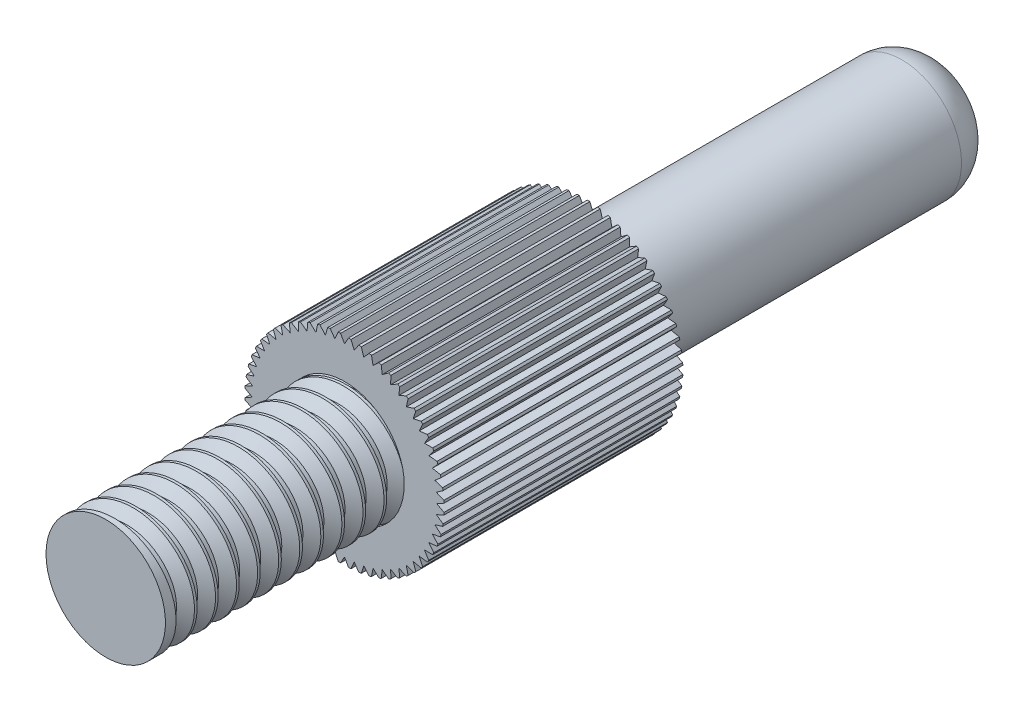
from build123d import *

# Parameters (mm, degrees)
SKETCH_1_R              = 1.5
EXTRUDE_1_DEPTH         = 21
EXTRUDE_START           = -9
SKETCH_2_R              = 2.5
EXTRUDE_2_DEPTH         = 6
CUT_EXTRUDE_START       = -6
CUT_EXTRUDE_3_OUTLINE_R = 2.5
CUT_EXTRUDE_3_DEPTH     = 6
THREAD_1_PITCH          = 0.529166667
FILLET_1_R              = 1


# Read off the part's stored shape, not the designer's step: Вырез-Вытянуть3
with BuildPart() as part:
    # Sketch 1 → Бобышка-Вытянуть1 (new body)
    with BuildSketch(Plane.XY):
        with Locations(Location((0, 0, 0), (0, 0, 180))):
            Circle(SKETCH_1_R)
    extrude(amount=EXTRUDE_1_DEPTH)

    # Эскиз2 → Бобышка-Вытянуть2 (add)
    with BuildSketch(Plane(origin=(0, 0, 0), x_dir=(-1, 0, 0), z_dir=(0, 0, -1)).offset(EXTRUDE_START)):
        Circle(SKETCH_2_R)
    extrude(amount=-EXTRUDE_2_DEPTH)

    # Вырез-Вытянуть3 outline → Вырез-Вытянуть3 (cut)
    with BuildSketch(Plane(origin=(0, 0, 9), x_dir=(-1, 0, 0), z_dir=(0, 0, -1)).offset(CUT_EXTRUDE_START)):
        Circle(CUT_EXTRUDE_3_OUTLINE_R)
        with BuildLine():
            ThreePointArc((-0.421477618, 2.463869725), (-0.39103289, 2.468884502), (-0.360528582, 2.473523104))
            Line((-0.360528582, 2.473523104), (-0.242417774, 2.306451055))
            Line((-0.242417774, 2.306451055), (-0.161624203, 2.494428797))
            ThreePointArc((-0.161624203, 2.494428797), (-0.130822068, 2.496233762), (-0.1, 2.497658385))
            Line((-0.1, 2.497658385), (0, 2.319155632))
            Line((0, 2.319155632), (0.1, 2.497658385))
            ThreePointArc((0.1, 2.497658385), (0.130822068, 2.496233762), (0.161624203, 2.494428797))
            Line((0.161624203, 2.494428797), (0.242417774, 2.306451055))
            Line((0.242417774, 2.306451055), (0.360528582, 2.473523104))
            ThreePointArc((0.360528582, 2.473523104), (0.39103289, 2.468884502), (0.421477618, 2.463869725))
            Line((0.421477618, 2.463869725), (0.482179569, 2.268476518))
            Line((0.482179569, 2.268476518), (0.617107138, 2.422287387))
            ThreePointArc((0.617107138, 2.422287387), (0.646959474, 2.414485627), (0.676713235, 2.406315981))
            Line((0.676713235, 2.406315981), (0.716658503, 2.205648077))
            Line((0.716658503, 2.205648077), (0.866924539, 2.344512583))
            ThreePointArc((0.866924539, 2.344512583), (0.895797835, 2.333633143), (0.924534641, 2.322398136))
            Line((0.924534641, 2.322398136), (0.943285577, 2.118654094))
            Line((0.943285577, 2.118654094), (1.107243733, 2.241050808))
            ThreePointArc((1.107243733, 2.241050808), (1.134821646, 2.227212885), (1.162226652, 2.213035611))
            Line((1.162226652, 2.213035611), (1.159577816, 2.008447693))
            Line((1.159577816, 2.008447693), (1.335431733, 2.113035611))
            ThreePointArc((1.335431733, 2.113035611), (1.361412115, 2.096390817), (1.387185064, 2.079426604))
            Line((1.387185064, 2.079426604), (1.363165479, 1.876236319))
            Line((1.363165479, 1.876236319), (1.548988463, 1.961869554))
            ThreePointArc((1.548988463, 1.961869554), (1.573086668, 1.942600253), (1.596945187, 1.923034965))
            Line((1.596945187, 1.923034965), (1.551818015, 1.723468508))
            Line((1.551818015, 1.723468508), (1.745574152, 1.789208844))
            ThreePointArc((1.745574152, 1.789208844), (1.767526153, 1.767526153), (1.789208844, 1.745574152))
            Line((1.789208844, 1.745574152), (1.723468508, 1.551818015))
            Line((1.723468508, 1.551818015), (1.923034965, 1.596945187))
            ThreePointArc((1.923034965, 1.596945187), (1.942600253, 1.573086668), (1.961869554, 1.548988463))
            Line((1.961869554, 1.548988463), (1.876236319, 1.363165479))
            Line((1.876236319, 1.363165479), (2.079426604, 1.387185064))
            ThreePointArc((2.079426604, 1.387185064), (2.096390817, 1.361412115), (2.113035611, 1.335431733))
            Line((2.113035611, 1.335431733), (2.008447693, 1.159577816))
            Line((2.008447693, 1.159577816), (2.213035611, 1.162226652))
            ThreePointArc((2.213035611, 1.162226652), (2.227212885, 1.134821646), (2.241050808, 1.107243733))
            Line((2.241050808, 1.107243733), (2.118654094, 0.943285577))
            Line((2.118654094, 0.943285577), (2.322398136, 0.924534641))
            ThreePointArc((2.322398136, 0.924534641), (2.333633143, 0.895797835), (2.344512583, 0.866924539))
            Line((2.344512583, 0.866924539), (2.205648077, 0.716658503))
            Line((2.205648077, 0.716658503), (2.406315981, 0.676713235))
            ThreePointArc((2.406315981, 0.676713235), (2.414485627, 0.646959474), (2.422287387, 0.617107138))
            Line((2.422287387, 0.617107138), (2.268476518, 0.482179569))
            Line((2.268476518, 0.482179569), (2.463869725, 0.421477618))
            ThreePointArc((2.463869725, 0.421477618), (2.468884502, 0.39103289), (2.473523104, 0.360528582))
            Line((2.473523104, 0.360528582), (2.306451055, 0.242417774))
            Line((2.306451055, 0.242417774), (2.494428797, 0.161624203))
            ThreePointArc((2.494428797, 0.161624203), (2.496233762, 0.130822068), (2.497658385, 0.1))
            Line((2.497658385, 0.1), (2.319155632, 0))
            Line((2.319155632, 0), (2.497658385, -0.1))
            ThreePointArc((2.497658385, -0.1), (2.496233762, -0.130822068), (2.494428797, -0.161624203))
            Line((2.494428797, -0.161624203), (2.306451055, -0.242417774))
            Line((2.306451055, -0.242417774), (2.473523104, -0.360528582))
            ThreePointArc((2.473523104, -0.360528582), (2.468884502, -0.39103289), (2.463869725, -0.421477618))
            Line((2.463869725, -0.421477618), (2.268476518, -0.482179569))
            Line((2.268476518, -0.482179569), (2.422287387, -0.617107138))
            ThreePointArc((2.422287387, -0.617107138), (2.414485627, -0.646959474), (2.406315981, -0.676713235))
            Line((2.406315981, -0.676713235), (2.205648077, -0.716658503))
            Line((2.205648077, -0.716658503), (2.344512583, -0.866924539))
            ThreePointArc((2.344512583, -0.866924539), (2.333633143, -0.895797835), (2.322398136, -0.924534641))
            Line((2.322398136, -0.924534641), (2.118654094, -0.943285577))
            Line((2.118654094, -0.943285577), (2.241050808, -1.107243733))
            ThreePointArc((2.241050808, -1.107243733), (2.227212885, -1.134821646), (2.213035611, -1.162226652))
            Line((2.213035611, -1.162226652), (2.008447693, -1.159577816))
            Line((2.008447693, -1.159577816), (2.113035611, -1.335431733))
            ThreePointArc((2.113035611, -1.335431733), (2.096390817, -1.361412115), (2.079426604, -1.387185064))
            Line((2.079426604, -1.387185064), (1.876236319, -1.363165479))
            Line((1.876236319, -1.363165479), (1.961869554, -1.548988463))
            ThreePointArc((1.961869554, -1.548988463), (1.942600253, -1.573086668), (1.923034965, -1.596945187))
            Line((1.923034965, -1.596945187), (1.723468508, -1.551818015))
            Line((1.723468508, -1.551818015), (1.789208844, -1.745574152))
            ThreePointArc((1.789208844, -1.745574152), (1.767526153, -1.767526153), (1.745574152, -1.789208844))
            Line((1.745574152, -1.789208844), (1.551818015, -1.723468508))
            Line((1.551818015, -1.723468508), (1.596945187, -1.923034965))
            ThreePointArc((1.596945187, -1.923034965), (1.573086668, -1.942600253), (1.548988463, -1.961869554))
            Line((1.548988463, -1.961869554), (1.363165479, -1.876236319))
            Line((1.363165479, -1.876236319), (1.387185064, -2.079426604))
            ThreePointArc((1.387185064, -2.079426604), (1.361412115, -2.096390817), (1.335431733, -2.113035611))
            Line((1.335431733, -2.113035611), (1.159577816, -2.008447693))
            Line((1.159577816, -2.008447693), (1.162226652, -2.213035611))
            ThreePointArc((1.162226652, -2.213035611), (1.134821646, -2.227212885), (1.107243733, -2.241050808))
            Line((1.107243733, -2.241050808), (0.943285577, -2.118654094))
            Line((0.943285577, -2.118654094), (0.924534641, -2.322398136))
            ThreePointArc((0.924534641, -2.322398136), (0.895797835, -2.333633143), (0.866924539, -2.344512583))
            Line((0.866924539, -2.344512583), (0.716658503, -2.205648077))
            Line((0.716658503, -2.205648077), (0.676713235, -2.406315981))
            ThreePointArc((0.676713235, -2.406315981), (0.646959474, -2.414485627), (0.617107138, -2.422287387))
            Line((0.617107138, -2.422287387), (0.482179569, -2.268476518))
            Line((0.482179569, -2.268476518), (0.421477618, -2.463869725))
            ThreePointArc((0.421477618, -2.463869725), (0.39103289, -2.468884502), (0.360528582, -2.473523104))
            Line((0.360528582, -2.473523104), (0.242417774, -2.306451055))
            Line((0.242417774, -2.306451055), (0.161624203, -2.494428797))
            ThreePointArc((0.161624203, -2.494428797), (0.130822068, -2.496233762), (0.1, -2.497658385))
            Line((0.1, -2.497658385), (0, -2.319155632))
            Line((0, -2.319155632), (-0.1, -2.497658385))
            ThreePointArc((-0.1, -2.497658385), (-0.130822068, -2.496233762), (-0.161624203, -2.494428797))
            Line((-0.161624203, -2.494428797), (-0.242417774, -2.306451055))
            Line((-0.242417774, -2.306451055), (-0.360528582, -2.473523104))
            ThreePointArc((-0.360528582, -2.473523104), (-0.39103289, -2.468884502), (-0.421477618, -2.463869725))
            Line((-0.421477618, -2.463869725), (-0.482179569, -2.268476518))
            Line((-0.482179569, -2.268476518), (-0.617107138, -2.422287387))
            ThreePointArc((-0.617107138, -2.422287387), (-0.646959474, -2.414485627), (-0.676713235, -2.406315981))
            Line((-0.676713235, -2.406315981), (-0.716658503, -2.205648077))
            Line((-0.716658503, -2.205648077), (-0.866924539, -2.344512583))
            ThreePointArc((-0.866924539, -2.344512583), (-0.895797835, -2.333633143), (-0.924534641, -2.322398136))
            Line((-0.924534641, -2.322398136), (-0.943285577, -2.118654094))
            Line((-0.943285577, -2.118654094), (-1.107243733, -2.241050808))
            ThreePointArc((-1.107243733, -2.241050808), (-1.134821646, -2.227212885), (-1.162226652, -2.213035611))
            Line((-1.162226652, -2.213035611), (-1.159577816, -2.008447693))
            Line((-1.159577816, -2.008447693), (-1.335431733, -2.113035611))
            ThreePointArc((-1.335431733, -2.113035611), (-1.361412115, -2.096390817), (-1.387185064, -2.079426604))
            Line((-1.387185064, -2.079426604), (-1.363165479, -1.876236319))
            Line((-1.363165479, -1.876236319), (-1.548988463, -1.961869554))
            ThreePointArc((-1.548988463, -1.961869554), (-1.573086668, -1.942600253), (-1.596945187, -1.923034965))
            Line((-1.596945187, -1.923034965), (-1.551818015, -1.723468508))
            Line((-1.551818015, -1.723468508), (-1.745574152, -1.789208844))
            ThreePointArc((-1.745574152, -1.789208844), (-1.767526153, -1.767526153), (-1.789208844, -1.745574152))
            Line((-1.789208844, -1.745574152), (-1.723468508, -1.551818015))
            Line((-1.723468508, -1.551818015), (-1.923034965, -1.596945187))
            ThreePointArc((-1.923034965, -1.596945187), (-1.942600253, -1.573086668), (-1.961869554, -1.548988463))
            Line((-1.961869554, -1.548988463), (-1.876236319, -1.363165479))
            Line((-1.876236319, -1.363165479), (-2.079426604, -1.387185064))
            ThreePointArc((-2.079426604, -1.387185064), (-2.096390817, -1.361412115), (-2.113035611, -1.335431733))
            Line((-2.113035611, -1.335431733), (-2.008447693, -1.159577816))
            Line((-2.008447693, -1.159577816), (-2.213035611, -1.162226652))
            ThreePointArc((-2.213035611, -1.162226652), (-2.227212885, -1.134821646), (-2.241050808, -1.107243733))
            Line((-2.241050808, -1.107243733), (-2.118654094, -0.943285577))
            Line((-2.118654094, -0.943285577), (-2.322398136, -0.924534641))
            ThreePointArc((-2.322398136, -0.924534641), (-2.333633143, -0.895797835), (-2.344512583, -0.866924539))
            Line((-2.344512583, -0.866924539), (-2.205648077, -0.716658503))
            Line((-2.205648077, -0.716658503), (-2.406315981, -0.676713235))
            ThreePointArc((-2.406315981, -0.676713235), (-2.414485627, -0.646959474), (-2.422287387, -0.617107138))
            Line((-2.422287387, -0.617107138), (-2.268476518, -0.482179569))
            Line((-2.268476518, -0.482179569), (-2.463869725, -0.421477618))
            ThreePointArc((-2.463869725, -0.421477618), (-2.468884502, -0.39103289), (-2.473523104, -0.360528582))
            Line((-2.473523104, -0.360528582), (-2.306451055, -0.242417774))
            Line((-2.306451055, -0.242417774), (-2.494428797, -0.161624203))
            ThreePointArc((-2.494428797, -0.161624203), (-2.496233762, -0.130822068), (-2.497658385, -0.1))
            Line((-2.497658385, -0.1), (-2.319155632, 0))
            Line((-2.319155632, 0), (-2.497658385, 0.1))
            ThreePointArc((-2.497658385, 0.1), (-2.496233762, 0.130822068), (-2.494428797, 0.161624203))
            Line((-2.494428797, 0.161624203), (-2.306451055, 0.242417774))
            Line((-2.306451055, 0.242417774), (-2.473523104, 0.360528582))
            ThreePointArc((-2.473523104, 0.360528582), (-2.468884502, 0.39103289), (-2.463869725, 0.421477618))
            Line((-2.463869725, 0.421477618), (-2.268476518, 0.482179569))
            Line((-2.268476518, 0.482179569), (-2.422287387, 0.617107138))
            ThreePointArc((-2.422287387, 0.617107138), (-2.414485627, 0.646959474), (-2.406315981, 0.676713235))
            Line((-2.406315981, 0.676713235), (-2.205648077, 0.716658503))
            Line((-2.205648077, 0.716658503), (-2.344512583, 0.866924539))
            ThreePointArc((-2.344512583, 0.866924539), (-2.333633143, 0.895797835), (-2.322398136, 0.924534641))
            Line((-2.322398136, 0.924534641), (-2.118654094, 0.943285577))
            Line((-2.118654094, 0.943285577), (-2.241050808, 1.107243733))
            ThreePointArc((-2.241050808, 1.107243733), (-2.227212885, 1.134821646), (-2.213035611, 1.162226652))
            Line((-2.213035611, 1.162226652), (-2.008447693, 1.159577816))
            Line((-2.008447693, 1.159577816), (-2.113035611, 1.335431733))
            ThreePointArc((-2.113035611, 1.335431733), (-2.096390817, 1.361412115), (-2.079426604, 1.387185064))
            Line((-2.079426604, 1.387185064), (-1.876236319, 1.363165479))
            Line((-1.876236319, 1.363165479), (-1.961869554, 1.548988463))
            ThreePointArc((-1.961869554, 1.548988463), (-1.942600253, 1.573086668), (-1.923034965, 1.596945187))
            Line((-1.923034965, 1.596945187), (-1.723468508, 1.551818015))
            Line((-1.723468508, 1.551818015), (-1.789208844, 1.745574152))
            ThreePointArc((-1.789208844, 1.745574152), (-1.767526153, 1.767526153), (-1.745574152, 1.789208844))
            Line((-1.745574152, 1.789208844), (-1.551818015, 1.723468508))
            Line((-1.551818015, 1.723468508), (-1.596945187, 1.923034965))
            ThreePointArc((-1.596945187, 1.923034965), (-1.573086668, 1.942600253), (-1.548988463, 1.961869554))
            Line((-1.548988463, 1.961869554), (-1.363165479, 1.876236319))
            Line((-1.363165479, 1.876236319), (-1.387185064, 2.079426604))
            ThreePointArc((-1.387185064, 2.079426604), (-1.361412115, 2.096390817), (-1.335431733, 2.113035611))
            Line((-1.335431733, 2.113035611), (-1.159577816, 2.008447693))
            Line((-1.159577816, 2.008447693), (-1.162226652, 2.213035611))
            ThreePointArc((-1.162226652, 2.213035611), (-1.134821646, 2.227212885), (-1.107243733, 2.241050808))
            Line((-1.107243733, 2.241050808), (-0.943285577, 2.118654094))
            Line((-0.943285577, 2.118654094), (-0.924534641, 2.322398136))
            ThreePointArc((-0.924534641, 2.322398136), (-0.895797835, 2.333633143), (-0.866924539, 2.344512583))
            Line((-0.866924539, 2.344512583), (-0.716658503, 2.205648077))
            Line((-0.716658503, 2.205648077), (-0.676713235, 2.406315981))
            ThreePointArc((-0.676713235, 2.406315981), (-0.646959474, 2.414485627), (-0.617107138, 2.422287387))
            Line((-0.617107138, 2.422287387), (-0.482179569, 2.268476518))
            Line((-0.482179569, 2.268476518), (-0.421477618, 2.463869725))
        make_face(mode=Mode.SUBTRACT)
    extrude(amount=CUT_EXTRUDE_3_DEPTH, mode=Mode.SUBTRACT)

    # Резьба1: the profile of Sketch 1 2 profile screwed along a right-hand helix of 11.338583 turns, 6 arcs to a turn; built about Z, then put on its axis
    thread_1_z = Axis((0, 0, 0), (0, 0, 1))
    thread_1_corners = [(1.5003, 0, -0.000173205), (1.5003, 0, 0.463194037), (1.213580141, 0, 0.297656249), (1.213580141, 0, 0.165364583)]
    with BuildLine(mode=Mode.PRIVATE) as thread_1_profile:
        Line(thread_1_corners[0], thread_1_corners[1])
        Line(thread_1_corners[1], thread_1_corners[2])
        Line(thread_1_corners[2], thread_1_corners[3])
        Line(thread_1_corners[3], thread_1_corners[0])
    thread_1_cap = Face(thread_1_profile.wire())
    thread_1_turn_angles = [0, 30, 60, 90, 120, 150, 180, 210, 240, 270, 300, 330, 360]
    thread_1_turn_weights = [1, 0.8660254037844387, 1, 0.8660254037844387, 1, 0.8660254037844387, 1, 0.8660254037844387, 1, 0.8660254037844387, 1, 0.8660254037844387, 1]
    thread_1_turn_rails = [Edge.make_bspline([Vector(p[0], p[1], 0).rotate(thread_1_z, thread_1_turn_angles[k]) / thread_1_turn_weights[k] + Vector(0, 0, p[2] + THREAD_1_PITCH * thread_1_turn_angles[k] / 360) for k in range(13)], [0, 0, 0, 1, 1, 2, 2, 3, 3, 4, 4, 5, 5, 6, 6, 6], 2, thread_1_turn_weights) for p in thread_1_corners]
    thread_1_turn_sides = [Face.make_surface_from_curves(thread_1_turn_rails[p[0]], thread_1_turn_rails[p[1]]) for p in [(0, 1), (1, 2), (2, 3), (3, 0)]]
    thread_1_last_angles = [3960, 3990, 4020, 4050, 4080, 4080.94488189, 4081.88976378]
    thread_1_last_weights = [1, 0.8660254037844387, 1, 0.8660254037844387, 1, 0.9998640215936437, 1]
    thread_1_last_rails = [Edge.make_bspline([Vector(p[0], p[1], 0).rotate(thread_1_z, thread_1_last_angles[k]) / thread_1_last_weights[k] + Vector(0, 0, p[2] + THREAD_1_PITCH * thread_1_last_angles[k] / 360) for k in range(7)], [0, 0, 0, 1, 1, 2, 2, 3, 3, 3], 2, thread_1_last_weights) for p in thread_1_corners]
    thread_1_last_sides = [Face.make_surface_from_curves(thread_1_last_rails[p[0]], thread_1_last_rails[p[1]]) for p in [(0, 1), (1, 2), (2, 3), (3, 0)]]
    thread_1 = Plane(origin=(0, 0, 21), x_dir=(-1, 0, 0), z_dir=(0, 0, -1)) * Solid(Shell([*[p.moved(Location((0, 0, THREAD_1_PITCH * i))) for i in range(11) for p in thread_1_turn_sides], *thread_1_last_sides, thread_1_cap, thread_1_cap.rotate(thread_1_z, 4081.88976378).moved(Location((0, 0, THREAD_1_PITCH * 4081.88976378 / 360)))]))
    add(thread_1, mode=Mode.SUBTRACT)

    # Скругление1
    fillet_1_edges = [part.edges().sort_by_distance(p)[0] for p in [
        (1.5, 0, 0),
    ]]
    fillet(fillet_1_edges, radius=FILLET_1_R)


solid = part.part
